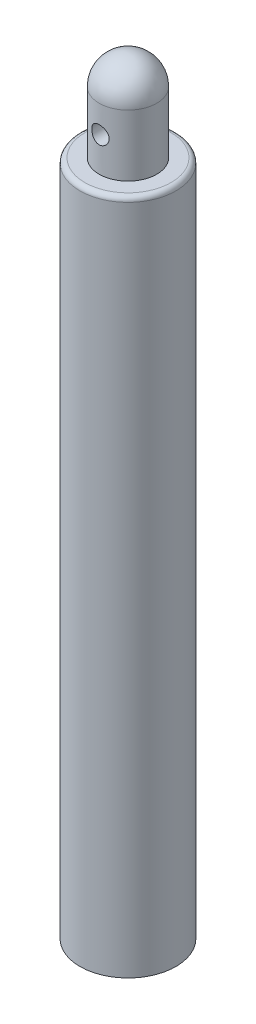
from build123d import *
from build123d.topology import SkipClean

# Parameters (mm, degrees)
SKETCH2_R                 = 4.955
BOTTOM_OF_MOUNT_DEPTH     = 69.85
SKETCH3_R                 = 2.975
TOP_OF_MOUNT_DEPTH        = 6.35
SKETCH4_R                 = 1
SCREW_CUT_IN_BOTTOM_DEPTH = 20
LOCK_IN_HOLE_DEPTH        = 77.52152671
LOCK_IN_HOLE_DEPTH_BACK   = 77.52152671
SKETCH6_R                 = 0.9
FILLET5_R                 = 0.5


with BuildPart() as part:
    # Sketch2 → Bottom of Mount (new body)
    with BuildSketch(Plane(origin=(0, 0, 0), x_dir=(1, 0, 0), z_dir=(0, 1, 0))):
        with Locations(Location((0, 0, 0), (0, 0, 270))):
            Circle(SKETCH2_R)
    extrude(amount=BOTTOM_OF_MOUNT_DEPTH)

    # Sketch3 → Top of Mount (add)
    with BuildSketch(Plane(origin=(0, 69.85, 0), x_dir=(1, 0, 0), z_dir=(0, 1, 0))):
        with Locations(Location((0, 0, 0), (0, 0, 270))):
            Circle(SKETCH3_R)
    extrude(amount=TOP_OF_MOUNT_DEPTH)

    # Sketch4 → Screw Cut in Bottom (cut)
    with BuildSketch(Plane.XZ):
        with Locations(Location((0, 0, 0), (0, 0, 270))):
            Circle(SKETCH4_R)
    extrude(amount=-SCREW_CUT_IN_BOTTOM_DEPTH, mode=Mode.SUBTRACT)

    # Sketch6 → Lock in hole (cut, two sides: drawn at the far end of the back side and taken through both)
    with BuildSketch(Plane.XY.offset(-LOCK_IN_HOLE_DEPTH_BACK)):
        with Locations(Location((0, 73.39, 0), (0, 0, 89.999999984))):
            Circle(SKETCH6_R)
    extrude(amount=LOCK_IN_HOLE_DEPTH + LOCK_IN_HOLE_DEPTH_BACK, mode=Mode.SUBTRACT)

    # Sketch9 → Circular Top (revolve)
    with SkipClean():  # the faces are left unmerged after this step: merging them gives an invalid solid
        with BuildSketch(Plane.XY):
            with BuildLine():
                Line((2.975, 76.2), (-2.975, 76.2))
                ThreePointArc((-2.975, 76.2), (0, 79.175), (2.975, 76.2))
            make_face()
        revolve(axis=Axis((2.975, 76.2, 0), (-1, 0, 0)))

    # Fillet5
    fillet5_edges = [part.edges().sort_by_distance(p)[0] for p in [
        (0, 69.85, -4.955),
    ]]
    fillet(fillet5_edges, radius=FILLET5_R)


solid = part.part
